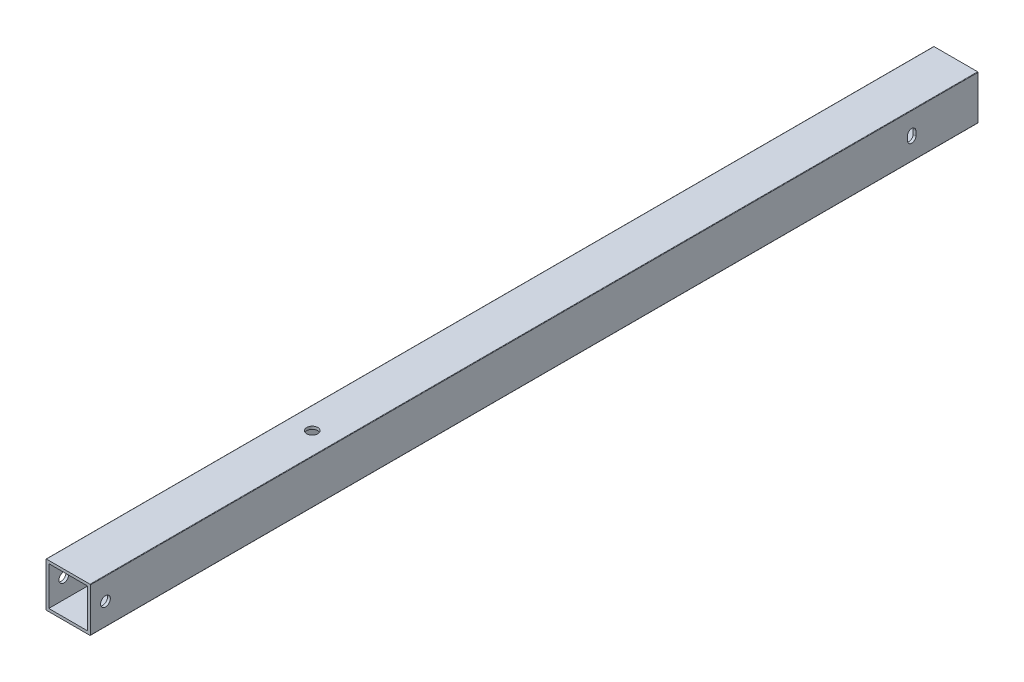
from build123d import *

# Parameters (mm, degrees)
SKETCH1_W           = 22.225
SKETCH1_H           = 22.225
BOSS_EXTRUDE1_DEPTH = 508
CUT_EXTRUDE2_DEPTH  = 510.191707666
SKETCH5_R           = 2.794
CUT_EXTRUDE3_DEPTH  = 25.4
SKETCH6_R           = 3.175
CUT_EXTRUDE4_DEPTH  = 510.191707666


with BuildPart() as part:
    # Sketch1 → Boss-Extrude1 (new body)
    with BuildSketch(Plane(origin=(0, 0, 0), x_dir=(-1, 0, 0), z_dir=(0, 0, -1))):
        with BuildLine():
            Line((1.5875, -1.3335), (1.5875, 23.5585))
            ThreePointArc((1.5875, 23.5585), (1.513105122, 23.738105122), (1.3335, 23.8125))
            Line((1.3335, 23.8125), (-23.5585, 23.8125))
            ThreePointArc((-23.5585, 23.8125), (-23.738105122, 23.738105122), (-23.8125, 23.5585))
            Line((-23.8125, 23.5585), (-23.8125, -1.3335))
            ThreePointArc((-23.8125, -1.3335), (-23.738105122, -1.513105122), (-23.5585, -1.5875))
            Line((-23.5585, -1.5875), (1.3335, -1.5875))
            ThreePointArc((1.3335, -1.5875), (1.513105122, -1.513105122), (1.5875, -1.3335))
        make_face()
        with Locations((-11.1125, 11.1125)):
            Rectangle(SKETCH1_W, SKETCH1_H, mode=Mode.SUBTRACT)
    extrude(amount=-BOSS_EXTRUDE1_DEPTH)

    # Sketch4 → Cut-Extrude2 (cut, through all)
    with BuildSketch(Plane(origin=(23.8125, 0, 0), x_dir=(0, 0, -1), z_dir=(1, 0, 0))):
        with BuildLine():
            ThreePointArc((-40.314518304, 9.8425), (-37.933268304, 7.46125), (-35.552018304, 9.8425))
            Line((-35.552018304, 9.8425), (-35.552018304, 12.3825))
            ThreePointArc((-35.552018304, 12.3825), (-37.933268304, 14.76375), (-40.314518304, 12.3825))
            Line((-40.314518304, 12.3825), (-40.314518304, 9.8425))
        make_face()
    extrude(amount=-CUT_EXTRUDE2_DEPTH, mode=Mode.SUBTRACT)

    # Sketch5 → Cut-Extrude3 (cut)
    with BuildSketch(Plane(origin=(23.8125, 0, 0), x_dir=(0, 0, -1), z_dir=(1, 0, 0))):
        with Locations((-499.364, 11.1125)):
            Circle(SKETCH5_R)
    extrude(amount=-CUT_EXTRUDE3_DEPTH, mode=Mode.SUBTRACT)

    # Sketch6 → Cut-Extrude4 (cut, through all)
    with BuildSketch(Plane.XZ.offset(1.5875)):
        with Locations((11.1125, 368.3)):
            Circle(SKETCH6_R)
    extrude(amount=-CUT_EXTRUDE4_DEPTH, mode=Mode.SUBTRACT)


solid = part.part
